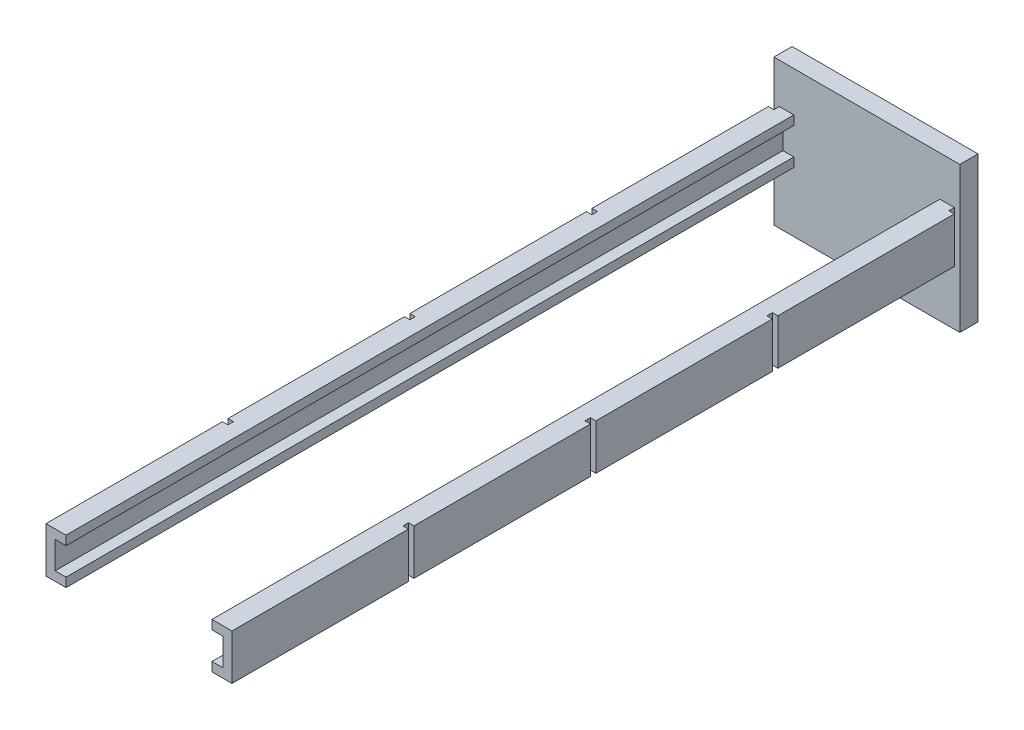
from build123d import *

# Parameters (mm, degrees)
BOSS_EXTRU_1_DEPTH         = 400
BOSS_EXTRU_1_2_DEPTH       = 400
ESQUISSE2_W                = 102.2
ESQUISSE2_H                = 80
BOSS_EXTRU_2_DEPTH         = 10
ESQUISSE3_W                = 2.991250027
ESQUISSE3_H                = 25
ENL_V_MAT_EXTRU_1_DEPTH    = 3
R_P_TITION_LIN_AIRE1_COUNT = 4
R_P_TITION_LIN_AIRE1_PITCH = 100
SYM_TRIE1_COPY_1_SKETCH_W  = 2.991250027
SYM_TRIE1_COPY_1_SKETCH_H  = 25
SYM_TRIE1_COPY_1_DEPTH     = 3
SYM_TRIE1_COPY_2_SKETCH_W  = 2.991250027
SYM_TRIE1_COPY_2_SKETCH_H  = 25
SYM_TRIE1_COPY_2_DEPTH     = 3
SYM_TRIE1_COPY_3_SKETCH_W  = 2.991250027
SYM_TRIE1_COPY_3_SKETCH_H  = 25
SYM_TRIE1_COPY_3_DEPTH     = 3
SYM_TRIE1_COPY_4_SKETCH_W  = 2.991250027
SYM_TRIE1_COPY_4_SKETCH_H  = 25
SYM_TRIE1_COPY_4_DEPTH     = 3


with BuildPart() as part:
    # Esquisse1 → Boss.-Extru.1 (new body)
    with BuildSketch(Plane.XY):
        Polygon((-40.1, -7.5), (-40.1, -12.5), (-51.1, -12.5), (-51.1, 12.5), (-40.1, 12.5), (-40.1, 7.5), (-46.1, 7.5), (-46.1, -7.5), align=None)
    extrude(amount=BOSS_EXTRU_1_DEPTH)



with BuildPart() as body_2:
    # Esquisse1 → Boss.-Extru.1 2 (new body)
    with BuildSketch(Plane.XY):
        Polygon((51.1, 12.5), (51.1, -12.5), (40.1, -12.5), (40.1, -7.5), (46.1, -7.5), (46.1, 7.5), (40.1, 7.5), (40.1, 12.5), align=None)
    extrude(amount=BOSS_EXTRU_1_2_DEPTH)


with BuildPart() as part_1:
    add(part.part)

    add(body_2.part)  # Boss.-Extru.2 merges body 2
    # Esquisse2 → Boss.-Extru.2 (add)
    with BuildSketch(Plane(origin=(0, 0, 0), x_dir=(-1, 0, 0), z_dir=(0, 0, -1))):
        with Locations((0, -5.441452085)):
            Rectangle(ESQUISSE2_W, ESQUISSE2_H)
    extrude(amount=BOSS_EXTRU_2_DEPTH)

    # Esquisse3 → Enlèv. mat.-Extru.1 (cut)
    with BuildSketch(Plane(origin=(51.1, 0, 0), x_dir=(0, 0, -1), z_dir=(1, 0, 0))):
        with Locations((-1.495625013, 0)):
            Rectangle(ESQUISSE3_W, ESQUISSE3_H)
    enl_v_mat_extru_1 = extrude(amount=-ENL_V_MAT_EXTRU_1_DEPTH, mode=Mode.SUBTRACT)

    # Répétition linéaire1: Enlèv. mat.-Extru.1 ×4
    with Locations(*[(0, 0, i * R_P_TITION_LIN_AIRE1_PITCH) for i in range(1, R_P_TITION_LIN_AIRE1_COUNT)]):
        add(enl_v_mat_extru_1, mode=Mode.SUBTRACT)

    # Symétrie1 copy 1 sketch → Symétrie1 copy 1 (cut)
    with BuildSketch(Plane(origin=(-51.1, 0, 100), x_dir=(0, 0, -1), z_dir=(-1, 0, 0))):
        with Locations((-1.495625013, 0)):
            Rectangle(SYM_TRIE1_COPY_1_SKETCH_W, SYM_TRIE1_COPY_1_SKETCH_H)
    extrude(amount=-SYM_TRIE1_COPY_1_DEPTH, mode=Mode.SUBTRACT)

    # Symétrie1 copy 2 sketch → Symétrie1 copy 2 (cut)
    with BuildSketch(Plane(origin=(-51.1, 0, 200), x_dir=(0, 0, -1), z_dir=(-1, 0, 0))):
        with Locations((-1.495625013, 0)):
            Rectangle(SYM_TRIE1_COPY_2_SKETCH_W, SYM_TRIE1_COPY_2_SKETCH_H)
    extrude(amount=-SYM_TRIE1_COPY_2_DEPTH, mode=Mode.SUBTRACT)

    # Symétrie1 copy 3 sketch → Symétrie1 copy 3 (cut)
    with BuildSketch(Plane(origin=(-51.1, 0, 300), x_dir=(0, 0, -1), z_dir=(-1, 0, 0))):
        with Locations((-1.495625013, 0)):
            Rectangle(SYM_TRIE1_COPY_3_SKETCH_W, SYM_TRIE1_COPY_3_SKETCH_H)
    extrude(amount=-SYM_TRIE1_COPY_3_DEPTH, mode=Mode.SUBTRACT)

    # Symétrie1 copy 4 sketch → Symétrie1 copy 4 (cut)
    with BuildSketch(Plane(origin=(-51.1, 0, 0), x_dir=(0, 0, -1), z_dir=(-1, 0, 0))):
        with Locations((-1.495625013, 0)):
            Rectangle(SYM_TRIE1_COPY_4_SKETCH_W, SYM_TRIE1_COPY_4_SKETCH_H)
    extrude(amount=-SYM_TRIE1_COPY_4_DEPTH, mode=Mode.SUBTRACT)


solid = part_1.part
